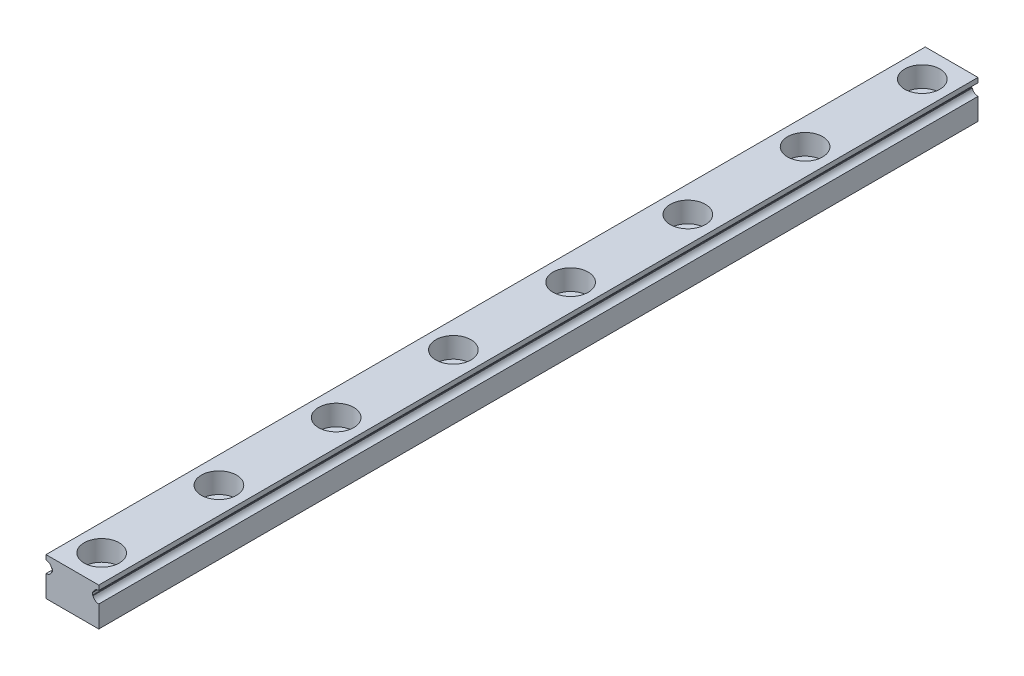
from build123d import *

# Parameters (mm, degrees)
EXTRUDE1_DEPTH  = 150
SKETCH2_R       = 3
EXTRUDE2_DEPTH  = 3.5
SKETCH_R        = 1.75
EXTRUDE3_DEPTH  = 151.208188858
LPATTERN1_COUNT = 40
LPATTERN1_PITCH = 20


with BuildPart() as part:
    # Sketch1 → Extrude1 (new body)
    with BuildSketch(Plane.XY):
        with BuildLine():
            Line((-4.5, -3.25), (4.5, -3.25))
            Line((4.5, -3.25), (4.5, 0.45))
            ThreePointArc((4.5, 0.45), (3.887627564, 0.659430585), (3.531754163, 1.2))
            Line((3.531754163, 1.2), (3.4, 1.2))
            Line((3.4, 1.2), (3.4, 1.7))
            Line((3.4, 1.7), (3.531754163, 1.7))
            ThreePointArc((3.531754163, 1.7), (3.887627564, 2.240569415), (4.5, 2.45))
            Line((4.5, 2.45), (4.5, 3.25))
            Line((4.5, 3.25), (-4.5, 3.25))
            Line((-4.5, 3.25), (-4.5, 2.45))
            ThreePointArc((-4.5, 2.45), (-3.887627564, 2.240569415), (-3.531754163, 1.7))
            Line((-3.531754163, 1.7), (-3.4, 1.7))
            Line((-3.4, 1.7), (-3.4, 1.2))
            Line((-3.4, 1.2), (-3.531754163, 1.2))
            ThreePointArc((-3.531754163, 1.2), (-3.887627564, 0.659430585), (-4.5, 0.45))
            Line((-4.5, 0.45), (-4.5, -3.25))
        make_face()
    extrude(amount=EXTRUDE1_DEPTH)

    # Sketch2 → Extrude2 (cut)
    with BuildSketch(Plane(origin=(0, 3.25, 0), x_dir=(1, 0, 0), z_dir=(0, 1, 0))):
        with Locations((0, -5)):
            Circle(SKETCH2_R)
    extrude2 = extrude(amount=-EXTRUDE2_DEPTH, mode=Mode.SUBTRACT)

    # Sketch → Extrude3 (cut, through all)
    with BuildSketch(Plane(origin=(0, 3.25, 0), x_dir=(1, 0, 0), z_dir=(0, 1, 0))):
        with Locations((0, -5)):
            Circle(SKETCH_R)
    extrude3 = extrude(amount=-EXTRUDE3_DEPTH, mode=Mode.SUBTRACT)

    # LPattern1: Extrude2, Extrude3 ×40
    with Locations(*[(0, 0, i * LPATTERN1_PITCH) for i in range(1, LPATTERN1_COUNT)]):
        add(extrude2, mode=Mode.SUBTRACT)
        add(extrude3, mode=Mode.SUBTRACT)


solid = part.part
